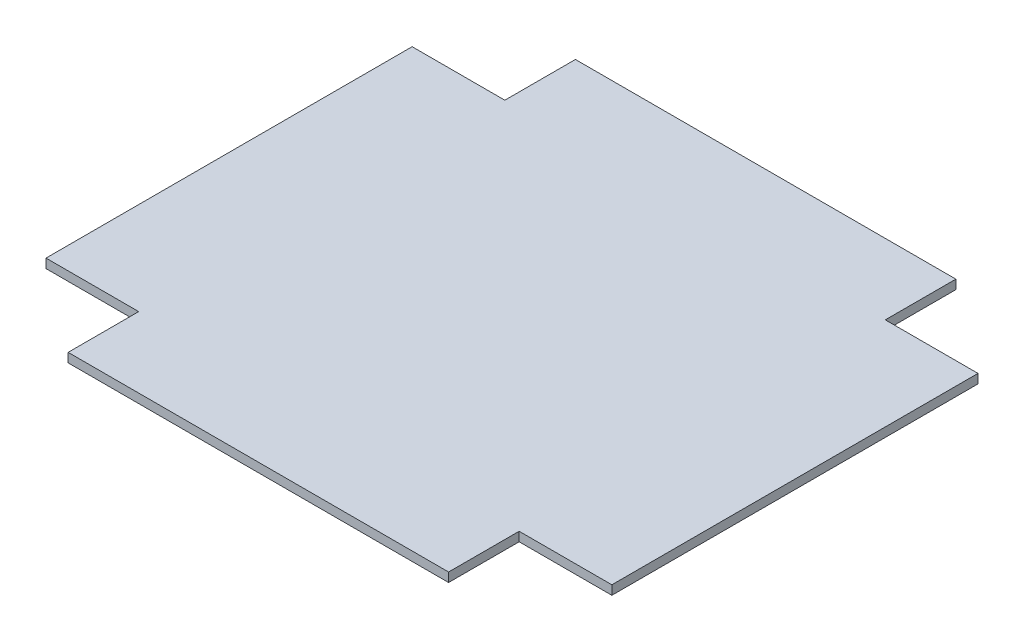
from build123d import *

# Parameters (mm, degrees)
BOSS_EXTRUDE1_DEPTH = 5.4864


with BuildPart() as part:
    # Sketch1 → Boss-Extrude1 (new body)
    with BuildSketch(Plane(origin=(0, 0, 0), x_dir=(1, 0, 0), z_dir=(0, 1, 0))):
        Polygon((114.3, -110), (170, -110), (170, 110), (114.3, 110), (114.3, 152.4), (-114.3, 152.4), (-114.3, 110), (-170, 110), (-170, -110), (-114.3, -110), (-114.3, -152.4), (114.3, -152.4), align=None)
    extrude(amount=BOSS_EXTRUDE1_DEPTH)


solid = part.part
